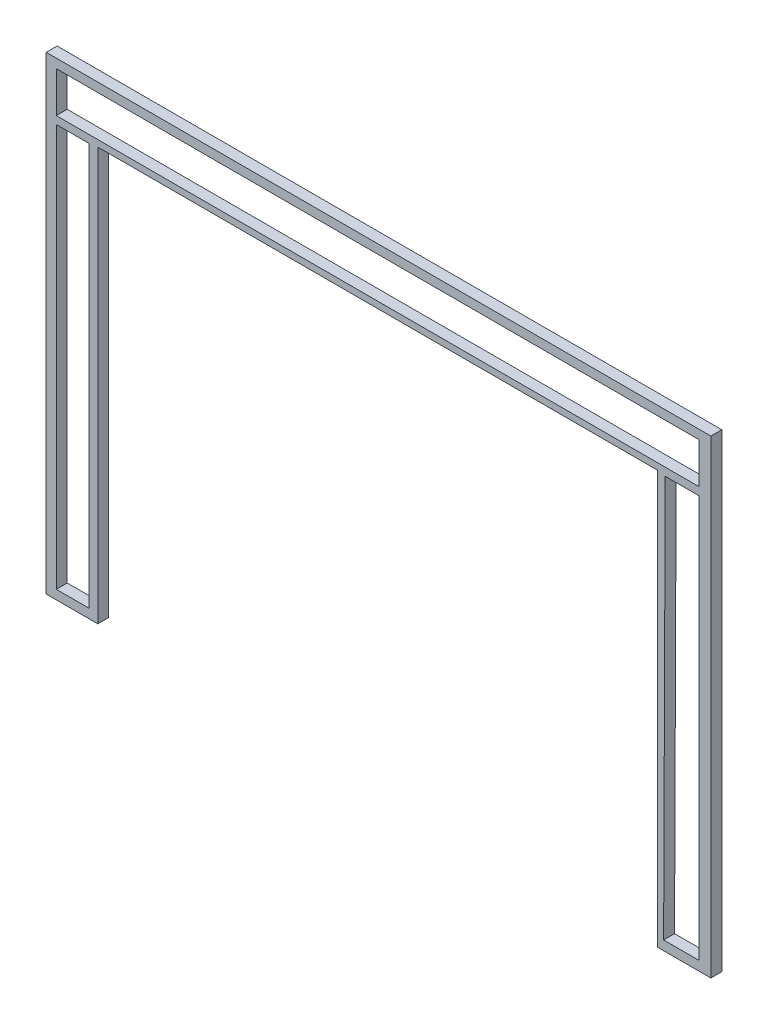
from build123d import *

# Parameters (mm, degrees)
CROQUIS1_W              = 30.062455219
CROQUIS1_H              = 368.411886759
SALIENTE_EXTRUIR1_DEPTH = 10


with BuildPart() as part:
    # Croquis1 → Saliente-Extruir1 (new body)
    with BuildSketch(Plane.XY):
        Polygon((-349.12977154, 1148.196546891), (-301.900012494, 1148.196546891), (-301.900012494, 1526.119621109), (210.142023646, 1526.119621109), (210.142023646, 1148.028247014), (259.193129355, 1148.028247014), (259.193129355, 1577.606387985), (-349.12977154, 1577.606387985), align=None)
        with Locations((-324.89008306, 1340.774076186)):
            Rectangle(CROQUIS1_W, CROQUIS1_H, mode=Mode.SUBTRACT)
        Polygon((215.959114526, 1156.568132807), (217.407822926, 1524.834083235), (248.374868009, 1524.834083235), (248.374868009, 1156.568132807), align=None, mode=Mode.SUBTRACT)
        Polygon((19.706711526, 1532.059808546), (-339.921310669, 1532.059808546), (-339.921310669, 1569.294202777), (19.706711526, 1569.294202777), (248.374868009, 1569.294202777), (248.374868009, 1532.059808546), align=None, mode=Mode.SUBTRACT)
    extrude(amount=SALIENTE_EXTRUIR1_DEPTH)


solid = part.part
